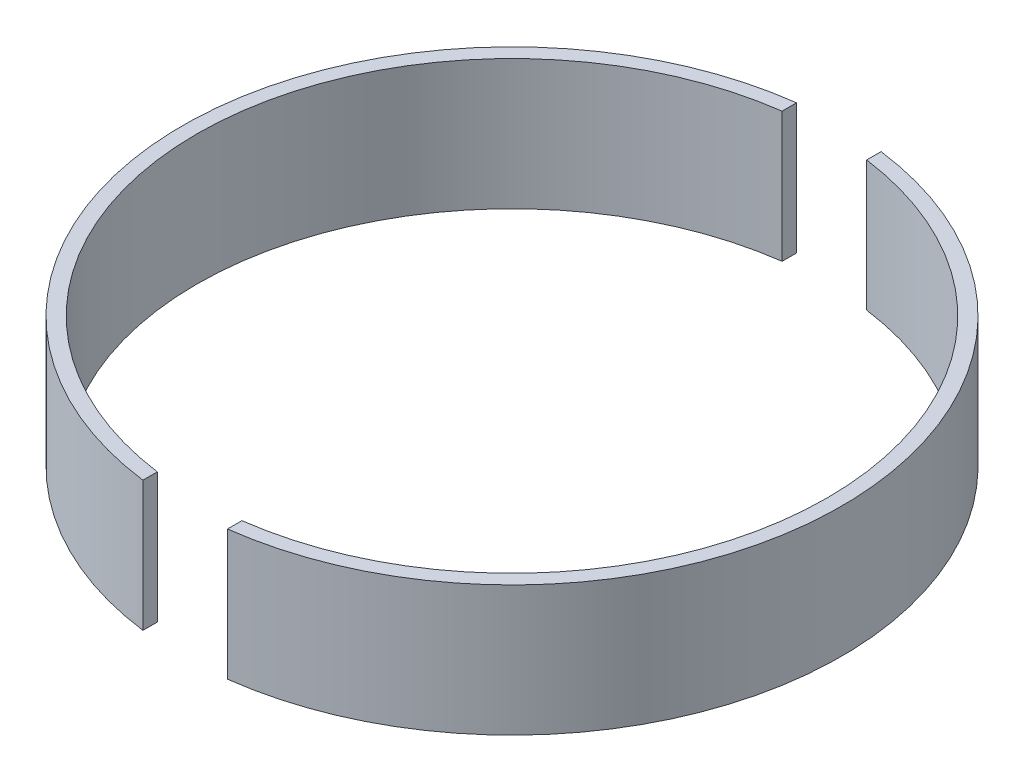
from build123d import *

# Parameters (mm, degrees)
ESQUISSE1_R             = 76
ESQUISSE1_R_2           = 72.7
BOSS_EXTRU_1_DEPTH      = 30
ESQUISSE2_W             = 19.5
ESQUISSE2_H             = 193.271911375
ENL_V_MAT_EXTRU_1_DEPTH = 112.588529877


with BuildPart() as part:
    # Esquisse1 → Boss.-Extru.1 (new body)
    with BuildSketch(Plane(origin=(0, 0, 0), x_dir=(1, 0, 0), z_dir=(0, 1, 0))):
        Circle(ESQUISSE1_R)
        Circle(ESQUISSE1_R_2, mode=Mode.SUBTRACT)
    extrude(amount=BOSS_EXTRU_1_DEPTH)

    # Esquisse2 → Enlèv. mat.-Extru.1 (cut, through all)
    with BuildSketch(Plane.XZ):
        with Locations((0, 2.659026004)):
            Rectangle(ESQUISSE2_W, ESQUISSE2_H)
    extrude(amount=-ENL_V_MAT_EXTRU_1_DEPTH, mode=Mode.SUBTRACT)


with BuildPart() as enl_v_mat_extru_1_piece_1:
    # of the separate pieces the step leaves, piece 1, a body of its own (enl_v_mat_extru_1_pieces)
    add(part.part.solids().sort_by_distance((-9.75, 0, -75.371994136))[0])


with BuildPart() as enl_v_mat_extru_1_piece_2:
    # of the separate pieces the step leaves, piece 2, a body of its own (enl_v_mat_extru_1_pieces)
    add(part.part.solids().sort_by_distance((9.75, 0, 75.371994136))[0])


solid = Compound([enl_v_mat_extru_1_piece_1.part, enl_v_mat_extru_1_piece_2.part])
